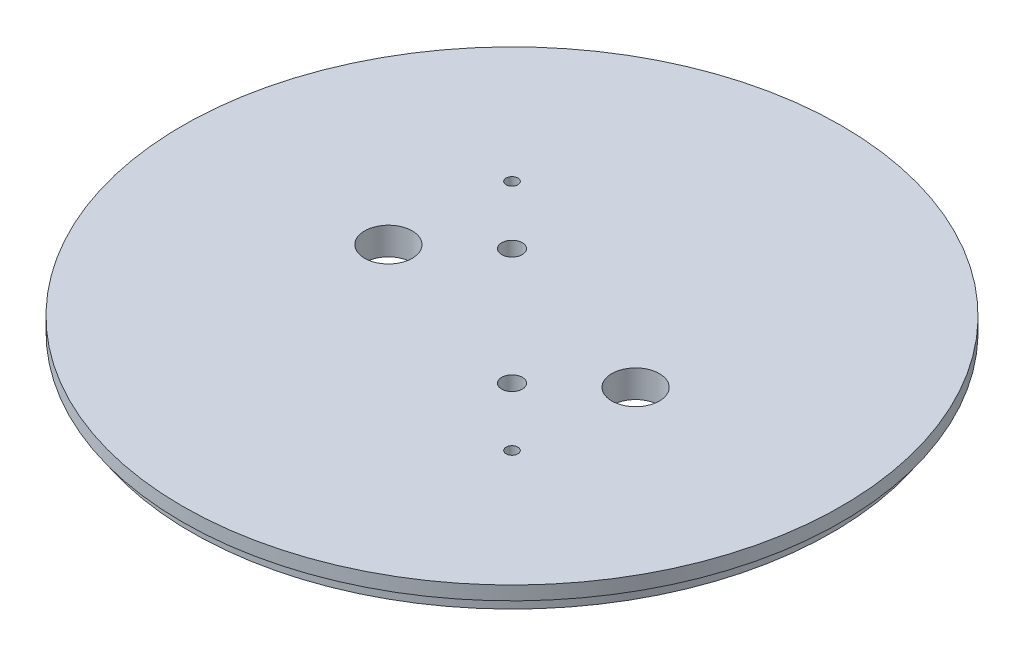
from build123d import *

# Parameters (mm, degrees)
SKETCH1_R           = 76.2
SKETCH1_R_2         = 5.500000049
SKETCH1_R_3         = 1.3589
SKETCH1_R_4         = 2.38125
BOSS_EXTRUDE1_DEPTH = 6.35
SKETCH2_R           = 76.2
SKETCH2_R_2         = 74.041
CUT_EXTRUDE1_DEPTH  = 3.175
CUT_EXTRUDE2_START  = -5.969
CUT_EXTRUDE2_DEPTH  = 3.556


with BuildPart() as part:
    # Sketch1 → Boss-Extrude1 (new body)
    with BuildSketch(Plane(origin=(0, 0, 0), x_dir=(1, 0, 0), z_dir=(0, 1, 0))):
        Circle(SKETCH1_R)
        with Locations((28.575, 0)):
            Circle(SKETCH1_R_2, mode=Mode.SUBTRACT)
        with Locations((-28.575, 0)):
            Circle(SKETCH1_R_2, mode=Mode.SUBTRACT)
        with Locations((-26.940768363, 26.940768363)):
            Circle(SKETCH1_R_3, mode=Mode.SUBTRACT)
        with Locations((26.940768363, -26.940768363)):
            Circle(SKETCH1_R_3, mode=Mode.SUBTRACT)
        with Locations((-13.470384182, 13.470384182)):
            Circle(SKETCH1_R_4, mode=Mode.SUBTRACT)
        with Locations((13.470384182, -13.470384182)):
            Circle(SKETCH1_R_4, mode=Mode.SUBTRACT)
    extrude(amount=BOSS_EXTRUDE1_DEPTH)

    # Sketch2 → Cut-Extrude1 (cut)
    with BuildSketch(Plane.XZ):
        Circle(SKETCH2_R)
        Circle(SKETCH2_R_2, mode=Mode.SUBTRACT)
    extrude(amount=-CUT_EXTRUDE1_DEPTH, mode=Mode.SUBTRACT)

    # Sketch3 → Cut-Extrude2 (cut)
    with BuildSketch(Plane(origin=(0, 6.35, 0), x_dir=(1, 0, 0), z_dir=(0, 1, 0)).offset(CUT_EXTRUDE2_START)):
        with BuildLine():
            Line((3.2385, 34.798), (3.2385, 13.97))
            ThreePointArc((3.2385, 13.97), (0, 10.7315), (-3.2385, 13.97))
            Line((-3.2385, 13.97), (-3.2385, 34.798))
            ThreePointArc((-3.2385, 34.798), (0, 38.0365), (3.2385, 34.798))
        make_face()
        with BuildLine():
            Line((3.2385, -34.798), (3.2385, -13.97))
            ThreePointArc((3.2385, -13.97), (0, -10.7315), (-3.2385, -13.97))
            Line((-3.2385, -13.97), (-3.2385, -34.798))
            ThreePointArc((-3.2385, -34.798), (0, -38.0365), (3.2385, -34.798))
        make_face()
    extrude(amount=-CUT_EXTRUDE2_DEPTH, mode=Mode.SUBTRACT)


solid = part.part
